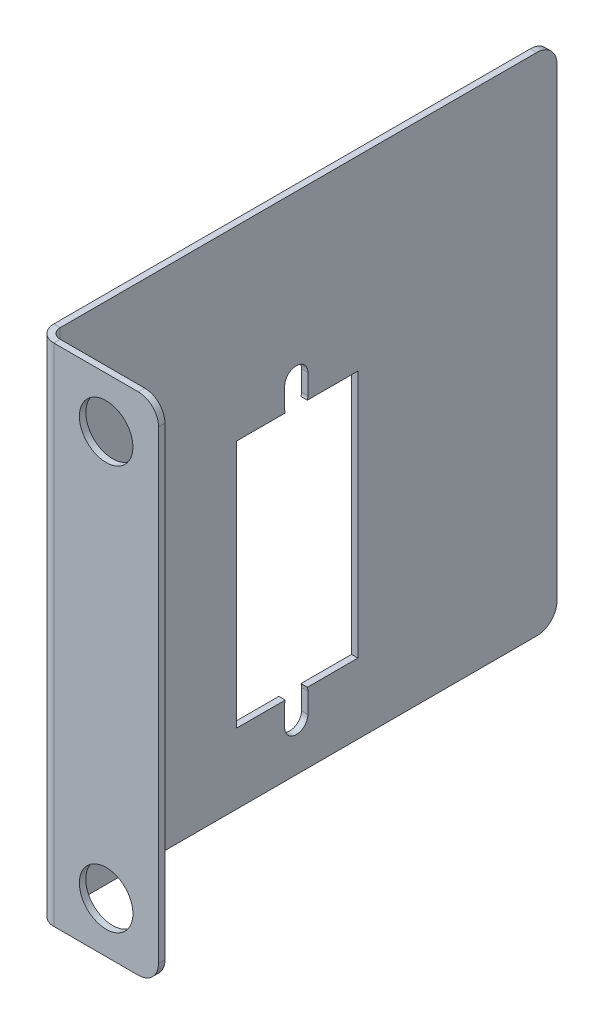
from build123d import *

# Parameters (mm, degrees)
SKETCH1_W                    = 50.8
SKETCH1_H                    = 50
BASE_FLANGE1_DEPTH           = 0.635
SKETCH9_W                    = 12
SKETCH9_H                    = 24.6
CUT_EXTRUDE1_DEPTH           = 36.644960724
CUT_EXTRUDE2_DEPTH           = 36.644960724
EDGE_FLANGE1_STRIP_W         = 4.54
EDGE_FLANGE1_STRIP_H         = 0.635
EDGE_FLANGE1_STRIP_CUT_DEPTH = 50
EDGE_FLANGE1_DEPTH           = 50
SKETCH14_R                   = 2.65
CUT_EXTRUDE3_DEPTH           = 58.189950603
FILLET1_R                    = 2


# Sheet-metal steps are written as plain solids
with BuildPart() as part:
    # Sketch1 → Base-Flange1 (new body)
    with BuildSketch(Plane(origin=(0, 0, 0), x_dir=(0, 0, -1), z_dir=(1, 0, 0))):
        Rectangle(SKETCH1_W, SKETCH1_H)
    extrude(amount=-BASE_FLANGE1_DEPTH)

    # Sketch9 → Cut-Extrude1 (cut, through all)
    with BuildSketch(Plane(origin=(0, 0, 0), x_dir=(0, 0, -1), z_dir=(1, 0, 0))):
        with Locations((-0.3, -5.75)):
            Rectangle(SKETCH9_W, SKETCH9_H)
    extrude(amount=-CUT_EXTRUDE1_DEPTH, mode=Mode.SUBTRACT)

    # Sketch10 → Cut-Extrude2 (cut, through all)
    with BuildSketch(Plane.ZY.offset(0.635)):
        with BuildLine():
            Line((-0.75, -20.4), (-0.75, -18.4))
            ThreePointArc((-0.75, -18.4), (0.4, -17.25), (1.55, -18.4))
            Line((1.55, -18.4), (1.55, -20.4))
            ThreePointArc((1.55, -20.4), (0.4, -21.55), (-0.75, -20.4))
        make_face()
        with BuildLine():
            Line((-0.75, 6.9), (-0.75, 8.9))
            ThreePointArc((-0.75, 8.9), (0.4, 10.05), (1.55, 8.9))
            Line((1.55, 8.9), (1.55, 6.9))
            ThreePointArc((1.55, 6.9), (0.4, 5.75), (-0.75, 6.9))
        make_face()
    extrude(amount=-CUT_EXTRUDE2_DEPTH, mode=Mode.SUBTRACT)

    # Edge-Flange1 strip (across the edge) → Edge-Flange1 strip cut (cut)
    with BuildSketch(Plane(origin=(0, 25, 25.4), x_dir=(0, 0, -1), z_dir=(0, -1, 0))):
        with Locations((-0.635, -0.3175)):
            Rectangle(EDGE_FLANGE1_STRIP_W, EDGE_FLANGE1_STRIP_H)
    extrude(amount=EDGE_FLANGE1_STRIP_CUT_DEPTH, mode=Mode.SUBTRACT)

    # Edge-Flange1 section (across the edge) → Edge-Flange1 (add)
    with BuildSketch(Plane(origin=(0, 25, 25.4), x_dir=(0, 0, -1), z_dir=(0, -1, 0))):
        with BuildLine():
            Line((0, 1), (0, 11.365))
            Line((0, 11.365), (0.635, 11.365))
            Line((0.635, 11.365), (0.635, 1))
            ThreePointArc((0.635, 1), (0.927893219, 0.292893219), (1.635, 0))
            Line((1.635, 0), (1.635, -0.635))
            ThreePointArc((1.635, -0.635), (0.478880413, -0.156119587), (0, 1))
        make_face()
    extrude(amount=EDGE_FLANGE1_DEPTH)

    # Sketch14 → Cut-Extrude3 (cut, through all)
    with BuildSketch(Plane(origin=(0, 0, 24.765), x_dir=(-1, 0, 0), z_dir=(0, 0, -1))):
        with Locations((-6.1825, -20)):
            Circle(SKETCH14_R)
        with Locations((-6.1825, 20)):
            Circle(SKETCH14_R)
    extrude(amount=-CUT_EXTRUDE3_DEPTH, mode=Mode.SUBTRACT)

    # Fillet1
    fillet1_edges = [part.edges().sort_by_distance(p)[0] for p in [
        (11.365, 25, 25.0825),
        (11.365, -25, 25.0825),
        (-0.3175, -25, -25.4),
        (-0.3175, 25, -25.4),
    ]]
    fillet(fillet1_edges, radius=FILLET1_R)


solid = part.part
